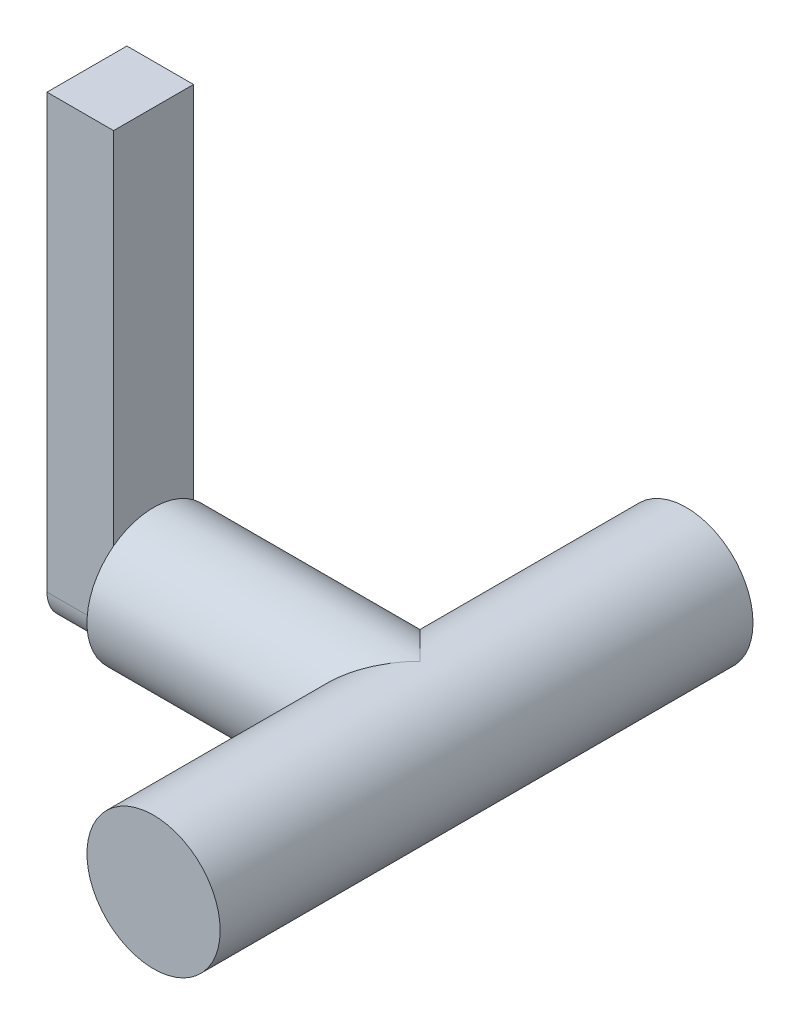
from build123d import *

# Parameters (mm, degrees)
SKETCH1_R      = 6.35
EXTRUDE1_DEPTH = 50.8
SKETCH2_R      = 6.35
EXTRUDE2_DEPTH = 25.4
SKETCH3_W      = 7.62
SKETCH3_H      = 44.45
EXTRUDE3_DEPTH = 6.35
FILLET1_R      = 3.175


with BuildPart() as part:
    # Sketch1 → Extrude1 (new body)
    with BuildSketch(Plane.XY):
        with Locations((-57.15, 50.8)):
            Circle(SKETCH1_R)
    extrude(amount=EXTRUDE1_DEPTH)

    # Sketch2 → Extrude2 (add)
    with BuildSketch(Plane(origin=(-57.15, 0, 0), x_dir=(0, 0, -1), z_dir=(1, 0, 0))):
        with Locations((-25.4, 50.8)):
            Circle(SKETCH2_R)
    extrude(amount=-EXTRUDE2_DEPTH)

    # Sketch3 → Extrude3 (add)
    with BuildSketch(Plane.ZY.offset(82.55)):
        with Locations((25.4, 67.945)):
            Rectangle(SKETCH3_W, SKETCH3_H)
    extrude(amount=EXTRUDE3_DEPTH)

    # Fillet1
    fillet1_edges = [part.edges().sort_by_distance(p)[0] for p in [
        (-85.725, 45.72, 29.21),
        (-85.725, 45.72, 21.59),
    ]]
    fillet(fillet1_edges, radius=FILLET1_R)


solid = part.part
